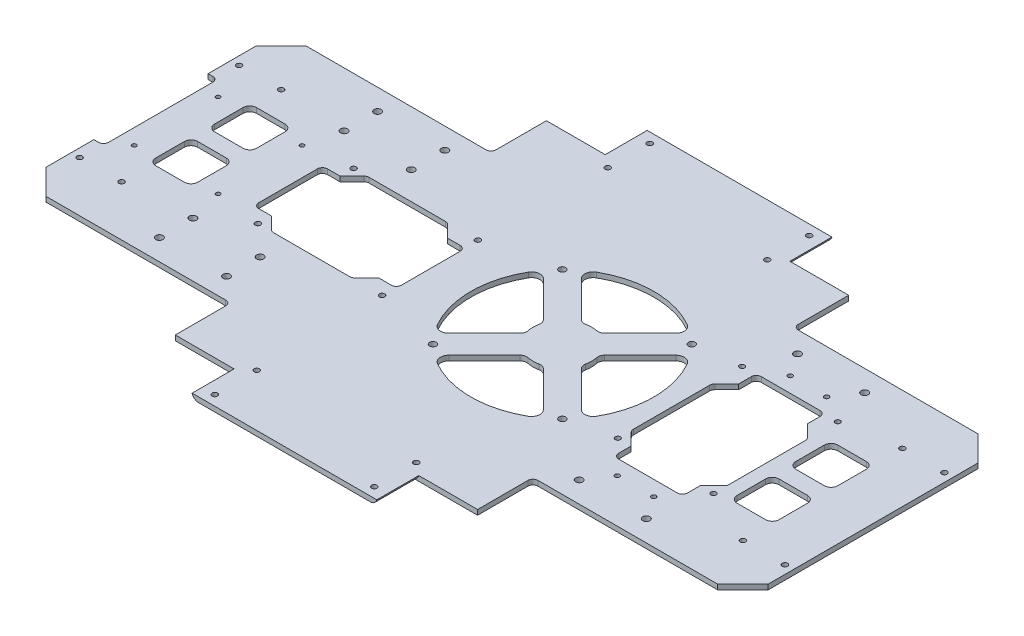
from build123d import *

# Parameters (mm, degrees)
EXTRUDE_1_DEPTH     = 3
FILLET_1_R          = 3
SKETCH_2_R          = 1.6
CUT_EXTRUDE_1_DEPTH = 47
SKETCH_3_R          = 2.1
SKETCH_3_R_2        = 1.4
SKETCH_3_R_3        = 1.25
CUT_EXTRUDE_2_DEPTH = 47
CHAMFER_1_SIZE      = 15
SKETCH_5_R          = 1.55
CUT_EXTRUDE_3_DEPTH = 47
SKETCH_6_R          = 1.6
CUT_EXTRUDE_4_DEPTH = 47
FILLET_2_R          = 3
CUT_EXTRUDE_5_DEPTH = 47
FILLET_3_R          = 3
CUT_EXTRUDE_6_DEPTH = 47
CUT_EXTRUDE_7_DEPTH = 10
SKETCH_12_W         = 54.313491237
SKETCH_12_H         = 75.831752035
EXTRUDE_5_DEPTH     = 3
SKETCH_15_W         = 41
SKETCH_15_H         = 10.5
SKETCH_15_H_2       = 32
EXTRUDE_6_DEPTH     = 16.5
FILLET_5_R          = 3
SKETCH_16_W         = 46.463317672
SKETCH_16_H         = 5.179474509
SKETCH_16_W_2       = 48.469975721
SKETCH_16_H_2       = 5.408539974
EXTRUDE_7_DEPTH     = 3
SKETCH_17_R         = 1.5
EXTRUDE_8_DEPTH     = 13
FILLET_6_R          = 4
SKETCH_19_R         = 13.147166569
EXTRUDE_11_DEPTH    = 3
SKETCH_20_R         = 2
CUT_EXTRUDE_8_DEPTH = 10


with BuildPart() as part:
    # 草图1 → 凸台-拉伸1 (new body)
    with BuildSketch(Plane(origin=(0, 0, 0), x_dir=(1, 0, 0), z_dir=(0, 1, 0))):
        Polygon((-82.930073268, 135.499923245), (-82.930073268, 112.499923245), (-47.930073268, 112.499923245), (-47.930073268, 77.499923245), (77.069926732, 77.499923245), (77.069926732, -77.499923245), (-47.930073268, -77.499923245), (-47.930073268, -112.499923245), (-82.930073268, -112.499923245), (-82.930073268, -135.499923245), (-192.930073268, -135.499923245), (-192.930073268, -112.499923245), (-227.930073268, -112.499923245), (-227.930073268, -77.499923245), (-352.930073268, -77.499923245), (-352.930073268, 77.499923245), (-227.930073268, 77.499923245), (-227.930073268, 112.499923245), (-192.930073268, 112.499923245), (-192.930073268, 135.499923245), align=None)
    extrude(amount=EXTRUDE_1_DEPTH)

    # 圆角1
    fillet_1_edges = [part.edges().sort_by_distance(p)[0] for p in [
        (-227.930073268, 1.5, 77.499923245),
        (-227.930073268, 1.5, -77.499923245),
        (-192.930073268, 1.5, -112.499923245),
        (-82.930073268, 1.5, -112.499923245),
        (-47.930073268, 1.5, -77.499923245),
        (-47.930073268, 1.5, 77.499923245),
        (-82.930073268, 1.5, 112.499923245),
        (-192.930073268, 1.5, 112.499923245),
    ]]
    fillet(fillet_1_edges, radius=FILLET_1_R)

    # 草图2 → 切除-拉伸1 (cut)
    with BuildSketch(Plane(origin=(0, 3, 0), x_dir=(1, 0, 0), z_dir=(0, 1, 0))):
        with Locations(Location((47.069926732, 47.5, 0), (0, 0, 270))):
            Circle(SKETCH_2_R)
        with Locations(Location((72.069926732, 47.5, 0), (0, 0, 270))):
            Circle(SKETCH_2_R)
        with Locations(Location((47.069926732, -47.5, 0), (0, 0, 270))):
            Circle(SKETCH_2_R)
        with Locations(Location((72.069926732, -47.5, 0), (0, 0, 270))):
            Circle(SKETCH_2_R)
        with Locations(Location((-185.430073268, 104.499923245, 0), (0, 0, 270))):
            Circle(SKETCH_2_R)
        with Locations(Location((-90.430073268, 129.499923245, 0), (0, 0, 270))):
            Circle(SKETCH_2_R)
        with Locations(Location((-90.430073268, 104.499923245, 0), (0, 0, 270))):
            Circle(SKETCH_2_R)
        with Locations(Location((-185.430073268, 129.499923245, 0), (0, 0, 270))):
            Circle(SKETCH_2_R)
        with Locations(Location((-185.430073268, -129.499923245, 0), (0, 0, 90))):
            Circle(SKETCH_2_R)
        with Locations(Location((-90.430073268, -104.499923245, 0), (0, 0, 90))):
            Circle(SKETCH_2_R)
        with Locations(Location((-90.430073268, -129.499923245, 0), (0, 0, 90))):
            Circle(SKETCH_2_R)
        with Locations(Location((-185.430073268, -104.499923245, 0), (0, 0, 90))):
            Circle(SKETCH_2_R)
        with Locations(Location((-347.930073268, -47.5, 0), (0, 0, 90))):
            Circle(SKETCH_2_R)
        with Locations(Location((-322.930073268, -47.5, 0), (0, 0, 90))):
            Circle(SKETCH_2_R)
        with Locations(Location((-347.930073268, 47.5, 0), (0, 0, 90))):
            Circle(SKETCH_2_R)
        with Locations(Location((-322.930073268, 47.5, 0), (0, 0, 90))):
            Circle(SKETCH_2_R)
    extrude(amount=-CUT_EXTRUDE_1_DEPTH, mode=Mode.SUBTRACT)

    # 草图3 → 切除-拉伸2 (cut)
    with BuildSketch(Plane(origin=(0, 3, 0), x_dir=(1, 0, 0), z_dir=(0, 1, 0))):
        with Locations(Location((-282.930073268, 65, 0), (0, 0, 270))):
            Circle(SKETCH_3_R)
        with Locations(Location((-282.930073268, 45, 0), (0, 0, 270))):
            Circle(SKETCH_3_R)
        with Locations(Location((-242.930073268, 65, 0), (0, 0, 270))):
            Circle(SKETCH_3_R)
        with Locations(Location((-242.930073268, 45, 0), (0, 0, 270))):
            Circle(SKETCH_3_R)
        with Locations(Location((-242.930073268, -45, 0), (0, 0, 90))):
            Circle(SKETCH_3_R)
        with Locations(Location((-242.930073268, -65, 0), (0, 0, 90))):
            Circle(SKETCH_3_R)
        with Locations(Location((-282.930073268, -45, 0), (0, 0, 90))):
            Circle(SKETCH_3_R)
        with Locations(Location((-282.930073268, -65, 0), (0, 0, 90))):
            Circle(SKETCH_3_R)
        with Locations(Location((7.069926732, -65, 0), (0, 0, 270))):
            Circle(SKETCH_3_R)
        with Locations(Location((7.069926732, -45, 0), (0, 0, 270))):
            Circle(SKETCH_3_R)
        with Locations(Location((-32.930073268, -65, 0), (0, 0, 270))):
            Circle(SKETCH_3_R)
        with Locations(Location((-32.930073268, -45, 0), (0, 0, 270))):
            Circle(SKETCH_3_R)
        with Locations(Location((-32.930073268, 45, 0), (0, 0, 90))):
            Circle(SKETCH_3_R)
        with Locations(Location((-32.930073268, 65, 0), (0, 0, 90))):
            Circle(SKETCH_3_R)
        with Locations(Location((7.069926732, 45, 0), (0, 0, 90))):
            Circle(SKETCH_3_R)
        with Locations(Location((7.069926732, 65, 0), (0, 0, 90))):
            Circle(SKETCH_3_R)
        with Locations(Location((-23.76704514, -51.499999755, 0), (0, 0, 270))):
            Circle(SKETCH_3_R_2)
        with Locations(Location((-2.093100904, -51.499999755, 0), (0, 0, 270))):
            Circle(SKETCH_3_R_2)
        with Locations(Location((-23.767045988, 51.50000033, 0), (0, 0, 270))):
            Circle(SKETCH_3_R_2)
        with Locations(Location((-2.09310104, 51.50000033, 0), (0, 0, 270))):
            Circle(SKETCH_3_R_2)
        with Locations(Location((-337.930073268, 25, 0), (0, 0, 270))):
            Circle(SKETCH_3_R_3)
        with Locations(Location((-287.930073268, 25, 0), (0, 0, 270))):
            Circle(SKETCH_3_R_3)
        with Locations(Location((-287.930073268, -25, 0), (0, 0, 270))):
            Circle(SKETCH_3_R_3)
        with Locations(Location((-337.930073268, -25, 0), (0, 0, 270))):
            Circle(SKETCH_3_R_3)
        with BuildLine():
            Line((-30.125760882, 35), (4.265614346, 35))
            ThreePointArc((4.265614346, 35), (9.265614346, 30), (4.265614346, 25))
            Line((4.265614346, 25), (-8.930073268, 25))
            Line((-8.930073268, 25), (-12.930073268, 25))
            Line((-12.930073268, 25), (-30.125760882, 25))
            ThreePointArc((-30.125760882, 25), (-35.125760882, 30), (-30.125760882, 35))
        make_face()
        with BuildLine():
            Line((-30.125760882, 17.5), (4.265614346, 17.5))
            ThreePointArc((4.265614346, 17.5), (9.265614346, 12.5), (4.265614346, 7.5))
            Line((4.265614346, 7.5), (-30.125760882, 7.5))
            ThreePointArc((-30.125760882, 7.5), (-35.125760882, 12.5), (-30.125760882, 17.5))
        make_face()
        with BuildLine():
            Line((-30.125760882, -35), (4.265614346, -35))
            ThreePointArc((4.265614346, -35), (9.265614346, -30), (4.265614346, -25))
            Line((4.265614346, -25), (-30.125760882, -25))
            ThreePointArc((-30.125760882, -25), (-35.125760882, -30), (-30.125760882, -35))
        make_face()
        with BuildLine():
            Line((-30.125760882, -17.5), (4.265614346, -17.5))
            ThreePointArc((4.265614346, -17.5), (9.265614346, -12.5), (4.265614346, -7.5))
            Line((4.265614346, -7.5), (-30.125760882, -7.5))
            ThreePointArc((-30.125760882, -7.5), (-35.125760882, -12.5), (-30.125760882, -17.5))
        make_face()
    extrude(amount=-CUT_EXTRUDE_2_DEPTH, mode=Mode.SUBTRACT)

    # 倒角1
    chamfer_1_edges = [part.edges().sort_by_distance(p)[0] for p in [
        (-352.930073268, 1.5, 77.499923245),
        (-352.930073268, 1.5, -77.499923245),
        (77.069926732, 1.5, -77.499923245),
        (77.069926732, 1.5, 77.499923245),
    ]]
    chamfer(chamfer_1_edges, length=CHAMFER_1_SIZE)

    # 草图5 → 切除-拉伸3 (cut)
    with BuildSketch(Plane(origin=(0, 3, 0), x_dir=(1, 0, 0), z_dir=(0, 1, 0))):
        with Locations(Location((-69.392753694, 38.537319575, 0), (0, 0, 270))):
            Circle(SKETCH_5_R)
        with Locations(Location((-69.392753694, -38.537319575, 0), (0, 0, 270))):
            Circle(SKETCH_5_R)
        with Locations(Location((-146.467392843, -38.537319575, 0), (0, 0, 270))):
            Circle(SKETCH_5_R)
        with Locations(Location((-146.467392843, 38.537319575, 0), (0, 0, 270))):
            Circle(SKETCH_5_R)
        with BuildLine():
            Line((-68.500078803, 28.116285966), (-89.658743207, 6.957621562))
            ThreePointArc((-89.658743207, 6.957621562), (-90.656276987, 5.296251914), (-90.755852303, 3.360972216))
            ThreePointArc((-90.755852303, 3.360972216), (-90.430073268, 0), (-90.755852303, -3.360972216))
            ThreePointArc((-90.755852303, -3.360972216), (-90.656276987, -5.296251914), (-89.658743207, -6.957621562))
            Line((-89.658743207, -6.957621562), (-68.500078803, -28.116285966))
            ThreePointArc((-68.500078803, -28.116285966), (-64.302140518, -29.536679868), (-60.624592537, -27.063656308))
            ThreePointArc((-60.624592537, -27.063656308), (-53.430073268, 0), (-60.624592537, 27.063656308))
            ThreePointArc((-60.624592537, 27.063656308), (-64.302140518, 29.536679868), (-68.500078803, 28.116285966))
        make_face()
        with BuildLine():
            Line((-79.813787302, -39.429994465), (-100.972451706, -18.271330061))
            ThreePointArc((-100.972451706, -18.271330061), (-102.633821354, -17.273796281), (-104.569101052, -17.174220965))
            ThreePointArc((-104.569101052, -17.174220965), (-107.930073268, -17.5), (-111.291045485, -17.174220965))
            ThreePointArc((-111.291045485, -17.174220965), (-113.226325182, -17.273796281), (-114.88769483, -18.271330061))
            Line((-114.88769483, -18.271330061), (-136.046359234, -39.429994465))
            ThreePointArc((-136.046359234, -39.429994465), (-137.466753136, -43.62793275), (-134.993729577, -47.305480731))
            ThreePointArc((-134.993729577, -47.305480731), (-107.930073268, -54.5), (-80.86641696, -47.305480731))
            ThreePointArc((-80.86641696, -47.305480731), (-78.3933934, -43.62793275), (-79.813787302, -39.429994465))
        make_face()
        with BuildLine():
            Line((-147.360067733, -28.116285966), (-126.201403329, -6.957621562))
            ThreePointArc((-126.201403329, -6.957621562), (-125.203869549, -5.296251914), (-125.104294233, -3.360972216))
            ThreePointArc((-125.104294233, -3.360972216), (-125.430073268, 0), (-125.104294233, 3.360972216))
            ThreePointArc((-125.104294233, 3.360972216), (-125.203869549, 5.296251914), (-126.201403329, 6.957621562))
            Line((-126.201403329, 6.957621562), (-147.360067733, 28.116285966))
            ThreePointArc((-147.360067733, 28.116285966), (-151.558006018, 29.536679868), (-155.235554, 27.063656308))
            ThreePointArc((-155.235554, 27.063656308), (-162.430073268, 0), (-155.235554, -27.063656308))
            ThreePointArc((-155.235554, -27.063656308), (-151.558006018, -29.536679868), (-147.360067733, -28.116285966))
        make_face()
        with BuildLine():
            Line((-136.046359234, 39.429994465), (-114.88769483, 18.271330061))
            ThreePointArc((-114.88769483, 18.271330061), (-113.226325182, 17.273796281), (-111.291045485, 17.174220965))
            ThreePointArc((-111.291045485, 17.174220965), (-107.930073268, 17.5), (-104.569101052, 17.174220965))
            ThreePointArc((-104.569101052, 17.174220965), (-102.633821354, 17.273796281), (-100.972451706, 18.271330061))
            Line((-100.972451706, 18.271330061), (-79.813787302, 39.429994465))
            ThreePointArc((-79.813787302, 39.429994465), (-78.3933934, 43.62793275), (-80.86641696, 47.305480731))
            ThreePointArc((-80.86641696, 47.305480731), (-107.930073268, 54.5), (-134.993729577, 47.305480731))
            ThreePointArc((-134.993729577, 47.305480731), (-137.466753136, 43.62793275), (-136.046359234, 39.429994465))
        make_face()
        with BuildLine():
            Line((-102.329796638, -7.703070081), (-102.329796638, 7.767864593))
            ThreePointArc((-102.329796638, 7.767864593), (-103.329796638, 8.767864593), (-104.329796638, 7.767864593))
            Line((-104.329796638, 7.767864593), (-104.329796638, 3.032397256))
            ThreePointArc((-104.329796638, 3.032397256), (-104.915583076, 1.618183694), (-106.329796638, 1.032397256))
            Line((-106.329796638, 1.032397256), (-116.930073268, 1.032397256))
            ThreePointArc((-116.930073268, 1.032397256), (-117.930073268, 0.032397256), (-116.930073268, -0.967602744))
            Line((-116.930073268, -0.967602744), (-106.329796638, -0.967602744))
            ThreePointArc((-106.329796638, -0.967602744), (-104.915583076, -1.553389182), (-104.329796638, -2.967602744))
            Line((-104.329796638, -2.967602744), (-104.329796638, -7.703070081))
            ThreePointArc((-104.329796638, -7.703070081), (-103.329796638, -8.703070081), (-102.329796638, -7.703070081))
        make_face()
    extrude(amount=-CUT_EXTRUDE_3_DEPTH, mode=Mode.SUBTRACT)

    # 草图6 → 切除-拉伸4 (cut)
    with BuildSketch(Plane(origin=(0, 3, 0), x_dir=(1, 0, 0), z_dir=(0, 1, 0))):
        with Locations(Location((-260.782474962, 28.5, 0), (0, 0, 270))):
            Circle(SKETCH_6_R)
        with Locations(Location((-186.782474962, 28.5, 0), (0, 0, 270))):
            Circle(SKETCH_6_R)
        with Locations(Location((-260.782474962, -28.5, 0), (0, 0, 270))):
            Circle(SKETCH_6_R)
        with Locations(Location((-186.782474962, -28.5, 0), (0, 0, 270))):
            Circle(SKETCH_6_R)
        Polygon((-270.282474962, -20.5), (-260.782474962, -20.5), (-252.782474962, -28.5), (-204.782474962, -28.5), (-196.782474962, -20.5), (-187.282474962, -20.5), (-186.282474962, -20.5), (-186.282474962, -19.5), (-186.282474962, 19.5), (-186.282474962, 20.5), (-187.282474962, 20.5), (-196.782474962, 20.5), (-204.782474962, 28.5), (-252.782474962, 28.5), (-260.782474962, 20.5), (-270.282474962, 20.5), (-271.282474962, 20.5), (-271.282474962, 19.5), (-271.282474962, -19.5), (-271.282474962, -20.5), align=None)
    extrude(amount=-CUT_EXTRUDE_4_DEPTH, mode=Mode.SUBTRACT)

    # 圆角2
    fillet_2_edges = [part.edges().sort_by_distance(p)[0] for p in [
        (-271.282474962, 1.5, 20.5),
        (-271.282474962, 1.5, -20.5),
        (-252.782474962, 1.5, -28.5),
        (-204.782474962, 1.5, -28.5),
        (-186.282474962, 1.5, -20.5),
        (-186.282474962, 1.5, 20.5),
        (-204.782474962, 1.5, 28.5),
        (-252.782474962, 1.5, 28.5),
    ]]
    fillet(fillet_2_edges, radius=FILLET_2_R)

    # 草图7 → 切除-拉伸5 (cut)
    with BuildSketch(Plane(origin=(0, 3, 0), x_dir=(1, 0, 0), z_dir=(0, 1, 0))):
        Polygon((-347.130073268, 0), (-347.130073268, 34), (-352.930073268, 34), (-352.930073268, -34), (-347.130073268, -34), align=None)
    extrude(amount=-CUT_EXTRUDE_5_DEPTH, mode=Mode.SUBTRACT)

    # 圆角3
    fillet_3_edges = [part.edges().sort_by_distance(p)[0] for p in [
        (-347.130073268, 1.5, 34),
        (-347.130073268, 1.5, -34),
    ]]
    fillet(fillet_3_edges, radius=FILLET_3_R)

    # 草图8 → 切除-拉伸6 (cut)
    with BuildSketch(Plane(origin=(0, 3, 0), x_dir=(1, 0, 0), z_dir=(0, 1, 0))):
        with BuildLine():
            Line((-321.030465446, 5.960941227), (-304.030465446, 5.960941227))
            ThreePointArc((-304.030465446, 5.960941227), (-301.202038321, 7.132514102), (-300.030465446, 9.960941227))
            Line((-300.030465446, 9.960941227), (-300.030465446, 26.960941227))
            ThreePointArc((-300.030465446, 26.960941227), (-301.202038321, 29.789368352), (-304.030465446, 30.960941227))
            Line((-304.030465446, 30.960941227), (-321.030465446, 30.960941227))
            ThreePointArc((-321.030465446, 30.960941227), (-323.858892571, 29.789368352), (-325.030465446, 26.960941227))
            Line((-325.030465446, 26.960941227), (-325.030465446, 9.960941227))
            ThreePointArc((-325.030465446, 9.960941227), (-323.858892571, 7.132514102), (-321.030465446, 5.960941227))
        make_face()
        with BuildLine():
            Line((-300.030465446, -8.039058773), (-300.030465446, -25.039058773))
            ThreePointArc((-300.030465446, -25.039058773), (-301.202038321, -27.867485898), (-304.030465446, -29.039058773))
            Line((-304.030465446, -29.039058773), (-321.030465446, -29.039058773))
            ThreePointArc((-321.030465446, -29.039058773), (-323.858892571, -27.867485898), (-325.030465446, -25.039058773))
            Line((-325.030465446, -25.039058773), (-325.030465446, -8.039058773))
            ThreePointArc((-325.030465446, -8.039058773), (-323.858892571, -5.210631648), (-321.030465446, -4.039058773))
            Line((-321.030465446, -4.039058773), (-304.030465446, -4.039058773))
            ThreePointArc((-304.030465446, -4.039058773), (-301.202038321, -5.210631648), (-300.030465446, -8.039058773))
        make_face()
        with BuildLine():
            ThreePointArc((22.069926732, 26), (23.241499607, 28.828427125), (26.069926732, 30))
            Line((26.069926732, 30), (43.069926732, 30))
            ThreePointArc((43.069926732, 30), (45.898353857, 28.828427125), (47.069926732, 26))
            Line((47.069926732, 26), (47.069926732, 9))
            ThreePointArc((47.069926732, 9), (45.898353857, 6.171572875), (43.069926732, 5))
            Line((43.069926732, 5), (26.069926732, 5))
            ThreePointArc((26.069926732, 5), (23.241499607, 6.171572875), (22.069926732, 9))
            Line((22.069926732, 9), (22.069926732, 26))
        make_face()
        with BuildLine():
            Line((26.069926732, -5), (43.069926732, -5))
            ThreePointArc((43.069926732, -5), (45.898353857, -6.171572875), (47.069926732, -9))
            Line((47.069926732, -9), (47.069926732, -26))
            ThreePointArc((47.069926732, -26), (45.898353857, -28.828427125), (43.069926732, -30))
            Line((43.069926732, -30), (26.069926732, -30))
            ThreePointArc((26.069926732, -30), (23.241499607, -28.828427125), (22.069926732, -26))
            Line((22.069926732, -26), (22.069926732, -9))
            ThreePointArc((22.069926732, -9), (23.241499607, -6.171572875), (26.069926732, -5))
        make_face()
    extrude(amount=-CUT_EXTRUDE_6_DEPTH, mode=Mode.SUBTRACT)

    # 草图9 → 切除-拉伸7 (cut)
    with BuildSketch(Plane(origin=(0, 3, 0), x_dir=(1, 0, 0), z_dir=(0, 1, 0))):
        Polygon((-227.930073268, 112.499923245), (-198.566720151, 112.499923245), (-197.043508076, 116.77154794), (-192.930073268, 116.77154794), (-192.930073268, 112.499923245), (-192.930073268, 110.499923245), (-227.930073268, 110.499923245), align=None)
        Polygon((-78.816638461, 116.77154794), (-77.293426385, 112.499923245), (-47.930073268, 112.499923245), (-47.930073268, 110.499923245), (-82.930073268, 110.499923245), (-82.930073268, 112.499923245), (-82.930073268, 116.77154794), align=None)
        Polygon((-47.930073268, -112.499923245), (-77.293426385, -112.499923245), (-78.816638461, -116.77154794), (-82.930073268, -116.77154794), (-82.930073268, -112.499923245), (-82.930073268, -110.499923245), (-47.930073268, -110.499923245), align=None)
        Polygon((-197.043508076, -116.77154794), (-198.566720151, -112.499923245), (-227.930073268, -112.499923245), (-227.930073268, -110.499923245), (-192.930073268, -110.499923245), (-192.930073268, -112.499923245), (-192.930073268, -116.77154794), align=None)
    extrude(amount=-CUT_EXTRUDE_7_DEPTH, mode=Mode.SUBTRACT)

    # 草图12 → 凸台-拉伸5 (add)
    with BuildSketch(Plane(origin=(0, 3, 0), x_dir=(1, 0, 0), z_dir=(0, 1, 0))):
        with Locations((-11.896767695, 0.369489129)):
            Rectangle(SKETCH_12_W, SKETCH_12_H)
    extrude(amount=-EXTRUDE_5_DEPTH)


with BuildPart() as body_2:
    # 草图15 → 凸台-拉伸6 (new body)
    with BuildSketch(Plane(origin=(0, 3, 0), x_dir=(1, 0, 0), z_dir=(0, 1, 0))):
        with Locations((-14.430073268, 37.25)):
            Rectangle(SKETCH_15_W, SKETCH_15_H)
        with Locations((-14.430073268, 16)):
            Rectangle(SKETCH_15_W, SKETCH_15_H_2)
        Polygon((-42.930073268, 0), (-34.930073268, 0), (-34.930073268, 32), (-42.930073268, 24), align=None)
        Polygon((-34.930073268, -32), (-34.930073268, 0), (-42.930073268, 0), (-42.930073268, -24), align=None)
        with Locations((-14.430073268, -16)):
            Rectangle(SKETCH_15_W, SKETCH_15_H_2)
        with Locations((-14.430073268, -37.25)):
            Rectangle(SKETCH_15_W, SKETCH_15_H)
        Polygon((14.069926732, -24), (14.069926732, 0), (6.069926732, 0), (6.069926732, -32), align=None)
        Polygon((6.069926732, 0), (14.069926732, 0), (14.069926732, 24), (6.069926732, 32), align=None)
    extrude(amount=-EXTRUDE_6_DEPTH)


with BuildPart() as part_1:
    add(part.part)

    # Combine 2: cut body 2
    add(body_2.part, mode=Mode.SUBTRACT)

    # 圆角5
    fillet_5_edges = [part_1.edges().sort_by_distance(p)[0] for p in [
        (-42.930073268, 1.5, 24),
        (-42.930073268, 1.5, -24),
        (-34.930073268, 1.5, -42.5),
        (6.069926732, 1.5, -42.5),
        (14.069926732, 1.5, -24),
        (14.069926732, 1.5, 24),
        (6.069926732, 1.5, 42.5),
        (-34.930073268, 1.5, 42.5),
    ]]
    fillet(fillet_5_edges, radius=FILLET_5_R)

    # 草图16 → 凸台-拉伸7 (add)
    with BuildSketch(Plane(origin=(0, 3, 0), x_dir=(1, 0, 0), z_dir=(0, 1, 0))):
        with Locations((-12.646292022, 45.293129875)):
            Rectangle(SKETCH_16_W, SKETCH_16_H)
        with Locations((-13.002228392, -45.354166474)):
            Rectangle(SKETCH_16_W_2, SKETCH_16_H_2)
    extrude(amount=-EXTRUDE_7_DEPTH)


with BuildPart() as body_2_2:
    # 草图17 → 凸台-拉伸8 (new body)
    with BuildSketch(Plane(origin=(0, 3, 0), x_dir=(1, 0, 0), z_dir=(0, 1, 0))):
        with BuildLine():
            ThreePointArc((-41.430073268, -32), (-41.869413096, -30.939339828), (-42.930073268, -30.5))
            Line((-42.930073268, -30.5), (-42.930073268, -32))
            Line((-42.930073268, -32), (-41.430073268, -32))
        make_face()
        with BuildLine():
            Line((-42.930073268, -32), (-42.930073268, -30.5))
            ThreePointArc((-42.930073268, -30.5), (-43.99073344, -30.939339828), (-44.430073268, -32))
            Line((-44.430073268, -32), (-42.930073268, -32))
        make_face()
        with BuildLine():
            Line((-41.430073268, -32), (-42.930073268, -32))
            Line((-42.930073268, -32), (-42.930073268, -33.5))
            ThreePointArc((-42.930073268, -33.5), (-41.869413096, -33.060660172), (-41.430073268, -32))
        make_face()
        with BuildLine():
            Line((-42.930073268, -33.5), (-42.930073268, -32))
            Line((-42.930073268, -32), (-44.430073268, -32))
            ThreePointArc((-44.430073268, -32), (-43.99073344, -33.060660172), (-42.930073268, -33.5))
        make_face()
        with BuildLine():
            ThreePointArc((15.569926732, -32), (15.130586904, -30.939339828), (14.069926732, -30.5))
            Line((14.069926732, -30.5), (14.069926732, -32))
            Line((14.069926732, -32), (15.569926732, -32))
        make_face()
        with BuildLine():
            Line((14.069926732, -32), (14.069926732, -30.5))
            ThreePointArc((14.069926732, -30.5), (13.00926656, -30.939339828), (12.569926732, -32))
            Line((12.569926732, -32), (14.069926732, -32))
        make_face()
        with BuildLine():
            Line((14.069926732, -32), (12.569926732, -32))
            ThreePointArc((12.569926732, -32), (13.00926656, -33.060660172), (14.069926732, -33.5))
            Line((14.069926732, -33.5), (14.069926732, -32))
        make_face()
        with BuildLine():
            Line((15.569926732, -32), (14.069926732, -32))
            Line((14.069926732, -32), (14.069926732, -33.5))
            ThreePointArc((14.069926732, -33.5), (15.130586904, -33.060660172), (15.569926732, -32))
        make_face()
        with BuildLine():
            ThreePointArc((14.069926732, 43.5), (13.00926656, 43.060660172), (12.569926732, 42))
            Line((12.569926732, 42), (14.069926732, 42))
            Line((14.069926732, 42), (14.069926732, 43.5))
        make_face()
        with BuildLine():
            Line((14.069926732, 42), (12.569926732, 42))
            ThreePointArc((12.569926732, 42), (13.00926656, 40.939339828), (14.069926732, 40.5))
            Line((14.069926732, 40.5), (14.069926732, 42))
        make_face()
        with BuildLine():
            Line((14.069926732, 43.5), (14.069926732, 42))
            Line((14.069926732, 42), (15.569926732, 42))
            ThreePointArc((15.569926732, 42), (15.130586904, 43.060660172), (14.069926732, 43.5))
        make_face()
        with BuildLine():
            Line((15.569926732, 42), (14.069926732, 42))
            Line((14.069926732, 42), (14.069926732, 40.5))
            ThreePointArc((14.069926732, 40.5), (15.130586904, 40.939339828), (15.569926732, 42))
        make_face()
        with Locations(Location((-42.930073268, 42, 0), (0, 0, 270))):
            Circle(SKETCH_17_R)
    extrude(amount=-EXTRUDE_8_DEPTH)


with BuildPart() as part_2:
    add(part_1.part)

    # Combine 3: cut body 2 2
    add(body_2_2.part, mode=Mode.SUBTRACT)

    # 圆角6
    # the kernel refuses this fillet: 4 mm, written as the material it takes off along each edge
    with BuildSketch(Plane(origin=(-192.930073268, 0, -110.499923245), x_dir=(1, 0, 0), z_dir=(0, 0, -1)), Plane(origin=(-82.930073268, 0, -145.182381611), x_dir=(-1, 0, 0), z_dir=(0, 0, 1)), Plane(origin=(-192.930073268, 0, 145.182381611), x_dir=(1, 0, 0), z_dir=(0, 0, -1)), Plane(origin=(-82.930073268, 0, 110.499923245), x_dir=(-1, 0, 0), z_dir=(0, 0, 1))) as fillet_6_piece_1:
        with BuildLine():
            CenterArc((3.872983346, -4), FILLET_6_R, 90, 75.522487814)
            Line((0, -3), (-0.077459667, -2.98))
            ThreePointArc((-0.077459667, -2.98), (-0.08, -1.5), (-0.08, 0))
            Line((-0.08, 0), (0, 0.08))
            Line((0, 0.08), (3.872983346, 0.08))
            Line((3.872983346, 0.08), (3.872983346, 0))
        make_face()
    extrude(amount=34.682458366, mode=Mode.SUBTRACT)

    # 草图19 → 凸台-拉伸11 (add)
    with BuildSketch(Plane(origin=(0, 3, 0), x_dir=(1, 0, 0), z_dir=(0, 1, 0))):
        with Locations((-110.020601265, 1.032397256)):
            Circle(SKETCH_19_R)
    extrude(amount=-EXTRUDE_11_DEPTH)

    # 草图20 → 切除-拉伸8 (cut)
    with BuildSketch(Plane(origin=(0, 3, 0), x_dir=(1, 0, 0), z_dir=(0, 1, 0))):
        with Locations(Location((-69.392753694, -38.537319575, 0), (0, 0, 270))):
            Circle(SKETCH_20_R)
        with Locations(Location((-146.467392843, -38.537319575, 0), (0, 0, 270))):
            Circle(SKETCH_20_R)
        with Locations(Location((-146.467392843, 38.537319575, 0), (0, 0, 270))):
            Circle(SKETCH_20_R)
        with Locations(Location((-69.392753694, 38.537319575, 0), (0, 0, 270))):
            Circle(SKETCH_20_R)
    extrude(amount=-CUT_EXTRUDE_8_DEPTH, mode=Mode.SUBTRACT)


solid = part_2.part
